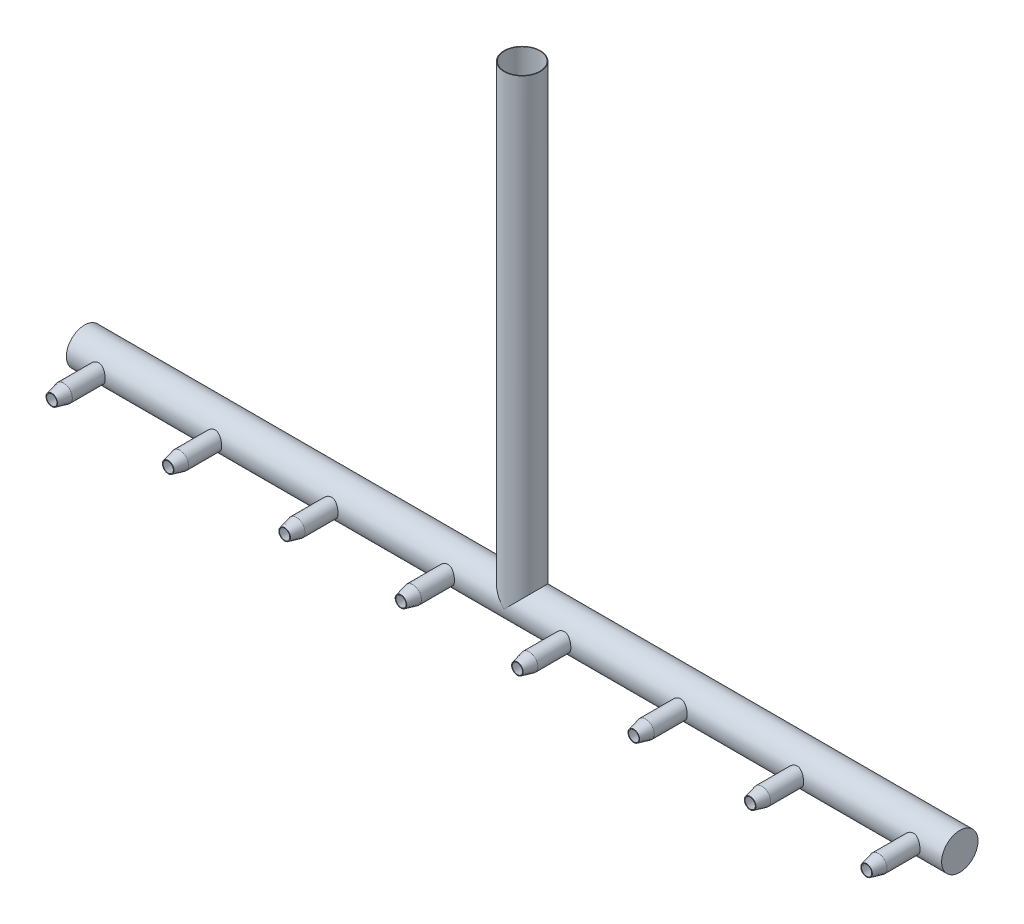
from build123d import *

# Parameters (mm, degrees)
SKETCH2_R                 = 156.33700000000002
SKETCH2_R_2               = 151.35859999999997
BOSS_EXTRUDE1_REACH       = 5631.615
BOSS_EXTRUDE1_END_RADIUS  = 156.33700000000002
SKETCH13_R                = 74.29999999999997
SKETCH13_R_2              = 69.04999999999994
LPATTERN1_COUNT           = 4
LPATTERN1_PITCH           = 1000
MIRROR2_COPY_1_REACH      = 5631.615
MIRROR2_COPY_1_END_RADIUS = 156.33700000000002
MIRROR2_COPY_1_SKETCH_R   = 74.29999999999997
MIRROR2_COPY_1_SKETCH_R_2 = 69.04999999999994
MIRROR2_COPY_2_REACH      = 5631.615
MIRROR2_COPY_2_END_RADIUS = 156.33700000000002
MIRROR2_COPY_2_SKETCH_R   = 74.29999999999997
MIRROR2_COPY_2_SKETCH_R_2 = 69.04999999999994
MIRROR2_COPY_3_REACH      = 5631.615
MIRROR2_COPY_3_END_RADIUS = 156.33700000000002
MIRROR2_COPY_3_SKETCH_R   = 74.29999999999997
MIRROR2_COPY_3_SKETCH_R_2 = 69.04999999999994
MIRROR2_COPY_7_REACH      = 5631.615
MIRROR2_COPY_7_END_RADIUS = 156.33700000000002
MIRROR2_COPY_7_SKETCH_R   = 74.29999999999997
MIRROR2_COPY_7_SKETCH_R_2 = 69.04999999999994
SKETCH18_R                = 151.3586
CUT_EXTRUDE1_DEPTH        = 8592.746576021646
BOSS_EXTRUDE2_START       = 9.9568
SKETCH17_R                = 156.33699999999993
BOSS_EXTRUDE2_DEPTH       = 9.9568


with BuildPart() as part:
    # Sweep2: sweep along a path in Sketch1
    with BuildLine(Plane.XY) as sweep2_path:
        Line((0, 0), (0, -4000))
        Line((0, -4000), (3750, -4000))
    # Sketch2 → Sweep2 (sweep)
    with BuildSketch(Plane(origin=(0, 0, 0), x_dir=(1, 0, 0), z_dir=(0, 1, 0))):
        Circle(SKETCH2_R)
        Circle(SKETCH2_R_2, mode=Mode.SUBTRACT)
    sweep(path=sweep2_path.line, transition=Transition.RIGHT)

    # Mirror1: part across plane


with BuildPart() as part_1:
    add(part.part)
    add(part.part.mirror(Plane(origin=(0, 0, 0), x_dir=(0, 0, 1), z_dir=(1, 0, 0))))

    # Boss-Extrude1: up to this cylinder (the profile starts outside it)
    boss_extrude1_end = Plane(origin=(427.801521, -4000, 0), z_dir=(1, 0, 0)) * Cylinder(BOSS_EXTRUDE1_END_RADIUS, 11576.904, mode=Mode.PRIVATE)
    # Sketch13 → Boss-Extrude1 (add, up to the surface)
    with BuildSketch(Plane.XY.offset(439.41999999999996), mode=Mode.PRIVATE) as boss_extrude1_sk1:
        with Locations((500, -4000)):
            Circle(SKETCH13_R)
        with Locations((500, -4000)):
            Circle(SKETCH13_R_2, mode=Mode.SUBTRACT)
    boss_extrude1_tool1 = extrude(boss_extrude1_sk1.sketch, amount=-BOSS_EXTRUDE1_REACH, mode=Mode.PRIVATE) - boss_extrude1_end
    boss_extrude1 = boss_extrude1_tool1.solids().sort_by_distance((427.801521, -4000, 439.42))[0]
    add(boss_extrude1)

    # Sketch15 → Revolve1 (revolve)
    with BuildSketch(Plane.ZY.offset(-500)):
        Polygon((439.41999999999996, -3925.7), (541.2688487982799, -3950.1508312316128), (541.2688487982799, -3955.55), (439.41999999999996, -3931.099168768387), align=None)
    revolve1 = revolve(axis=Axis((500, -4000, 439.41999999999996), (0, 0, 1)))

    # LPattern1: Boss-Extrude1, Revolve1 ×4
    with Locations(*[(i * LPATTERN1_PITCH, 0, 0) for i in range(1, LPATTERN1_COUNT)]):
        add(boss_extrude1)
        add(revolve1)

    # Mirror2 copy 1: up to this cylinder (the profile starts outside it)
    mirror2_copy_1_end = Plane(origin=(427.801521, -4000, 0), z_dir=(1, 0, 0)) * Cylinder(MIRROR2_COPY_1_END_RADIUS, 11576.904, mode=Mode.PRIVATE)
    # Mirror2 copy 1 sketch → Mirror2 copy 1 (add, up to the surface)
    with BuildSketch(Plane(origin=(-1000, 0, 439.41999999999996), x_dir=(-1, 0, 0), z_dir=(0, 0, 1)), mode=Mode.PRIVATE) as mirror2_copy_1_sk1:
        with Locations((500, 4000)):
            Circle(MIRROR2_COPY_1_SKETCH_R)
        with Locations((500, 4000)):
            Circle(MIRROR2_COPY_1_SKETCH_R_2, mode=Mode.SUBTRACT)
    mirror2_copy_1_tool1 = extrude(mirror2_copy_1_sk1.sketch, amount=-MIRROR2_COPY_1_REACH, mode=Mode.PRIVATE) - mirror2_copy_1_end
    add(mirror2_copy_1_tool1.solids().sort_by_distance((427.801521, -4000, 439.42))[0])

    # Mirror2 copy 2: up to this cylinder (the profile starts outside it)
    mirror2_copy_2_end = Plane(origin=(427.801521, -4000, 0), z_dir=(1, 0, 0)) * Cylinder(MIRROR2_COPY_2_END_RADIUS, 11576.904, mode=Mode.PRIVATE)
    # Mirror2 copy 2 sketch → Mirror2 copy 2 (add, up to the surface)
    with BuildSketch(Plane(origin=(-2000, 0, 439.41999999999996), x_dir=(-1, 0, 0), z_dir=(0, 0, 1)), mode=Mode.PRIVATE) as mirror2_copy_2_sk1:
        with Locations((500, 4000)):
            Circle(MIRROR2_COPY_2_SKETCH_R)
        with Locations((500, 4000)):
            Circle(MIRROR2_COPY_2_SKETCH_R_2, mode=Mode.SUBTRACT)
    mirror2_copy_2_tool1 = extrude(mirror2_copy_2_sk1.sketch, amount=-MIRROR2_COPY_2_REACH, mode=Mode.PRIVATE) - mirror2_copy_2_end
    add(mirror2_copy_2_tool1.solids().sort_by_distance((427.801521, -4000, 439.42))[0])

    # Mirror2 copy 3: up to this cylinder (the profile starts outside it)
    mirror2_copy_3_end = Plane(origin=(427.801521, -4000, 0), z_dir=(1, 0, 0)) * Cylinder(MIRROR2_COPY_3_END_RADIUS, 11576.904, mode=Mode.PRIVATE)
    # Mirror2 copy 3 sketch → Mirror2 copy 3 (add, up to the surface)
    with BuildSketch(Plane(origin=(-3000, 0, 439.41999999999996), x_dir=(-1, 0, 0), z_dir=(0, 0, 1)), mode=Mode.PRIVATE) as mirror2_copy_3_sk1:
        with Locations((500, 4000)):
            Circle(MIRROR2_COPY_3_SKETCH_R)
        with Locations((500, 4000)):
            Circle(MIRROR2_COPY_3_SKETCH_R_2, mode=Mode.SUBTRACT)
    mirror2_copy_3_tool1 = extrude(mirror2_copy_3_sk1.sketch, amount=-MIRROR2_COPY_3_REACH, mode=Mode.PRIVATE) - mirror2_copy_3_end
    add(mirror2_copy_3_tool1.solids().sort_by_distance((427.801521, -4000, 439.42))[0])

    # Mirror2 copy 4 sketch → Mirror2 copy 4 (revolve)
    with BuildSketch(Plane(origin=(-1500, 0, 0), x_dir=(0, 0, 1), z_dir=(1, 0, 0))):
        Polygon((439.41999999999996, 3925.7), (541.2688487982799, 3950.1508312316128), (541.2688487982799, 3955.55), (439.41999999999996, 3931.099168768387), align=None)
    revolve(axis=Axis((-1500, -4000, 439.41999999999996), (0, 0, -1)))

    # Mirror2 copy 5 sketch → Mirror2 copy 5 (revolve)
    with BuildSketch(Plane(origin=(-2500, 0, 0), x_dir=(0, 0, 1), z_dir=(1, 0, 0))):
        Polygon((439.41999999999996, 3925.7), (541.2688487982799, 3950.1508312316128), (541.2688487982799, 3955.55), (439.41999999999996, 3931.099168768387), align=None)
    revolve(axis=Axis((-2500, -4000, 439.41999999999996), (0, 0, -1)))

    # Mirror2 copy 6 sketch → Mirror2 copy 6 (revolve)
    with BuildSketch(Plane(origin=(-3500, 0, 0), x_dir=(0, 0, 1), z_dir=(1, 0, 0))):
        Polygon((439.41999999999996, 3925.7), (541.2688487982799, 3950.1508312316128), (541.2688487982799, 3955.55), (439.41999999999996, 3931.099168768387), align=None)
    revolve(axis=Axis((-3500, -4000, 439.41999999999996), (0, 0, -1)))

    # Mirror2 copy 7: up to this cylinder (the profile starts outside it)
    mirror2_copy_7_end = Plane(origin=(427.801521, -4000, 0), z_dir=(1, 0, 0)) * Cylinder(MIRROR2_COPY_7_END_RADIUS, 11576.904, mode=Mode.PRIVATE)
    # Mirror2 copy 7 sketch → Mirror2 copy 7 (add, up to the surface)
    with BuildSketch(Plane(origin=(0, 0, 439.41999999999996), x_dir=(-1, 0, 0), z_dir=(0, 0, 1)), mode=Mode.PRIVATE) as mirror2_copy_7_sk1:
        with Locations((500, 4000)):
            Circle(MIRROR2_COPY_7_SKETCH_R)
        with Locations((500, 4000)):
            Circle(MIRROR2_COPY_7_SKETCH_R_2, mode=Mode.SUBTRACT)
    mirror2_copy_7_tool1 = extrude(mirror2_copy_7_sk1.sketch, amount=-MIRROR2_COPY_7_REACH, mode=Mode.PRIVATE) - mirror2_copy_7_end
    add(mirror2_copy_7_tool1.solids().sort_by_distance((427.801521, -4000, 439.42))[0])

    # Mirror2 copy 8 sketch → Mirror2 copy 8 (revolve)
    with BuildSketch(Plane(origin=(-500, 0, 0), x_dir=(0, 0, 1), z_dir=(1, 0, 0))):
        Polygon((439.41999999999996, 3925.7), (541.2688487982799, 3950.1508312316128), (541.2688487982799, 3955.55), (439.41999999999996, 3931.099168768387), align=None)
    revolve(axis=Axis((-500, -4000, 439.41999999999996), (0, 0, -1)))

    # Sketch18 → Cut-Extrude1 (cut, through all)
    with BuildSketch(Plane.ZY.offset(3750.0000000000005)):
        with Locations((0, -3999.9999999999995)):
            Circle(SKETCH18_R)
    extrude(amount=-CUT_EXTRUDE1_DEPTH, mode=Mode.SUBTRACT)

    # Sketch17 → Boss-Extrude2 (add)
    with BuildSketch(Plane.ZY.offset(3750.0000000000005).offset(BOSS_EXTRUDE2_START)):
        with Locations((0, -3999.9999999999995)):
            Circle(SKETCH17_R)
    boss_extrude2 = extrude(amount=-BOSS_EXTRUDE2_DEPTH)

    # Mirror3: Boss-Extrude2 across plane
    add(boss_extrude2.mirror(Plane(origin=(0, 0, 0), x_dir=(0, 0, 1), z_dir=(1, 0, 0))))


solid = part_1.part
